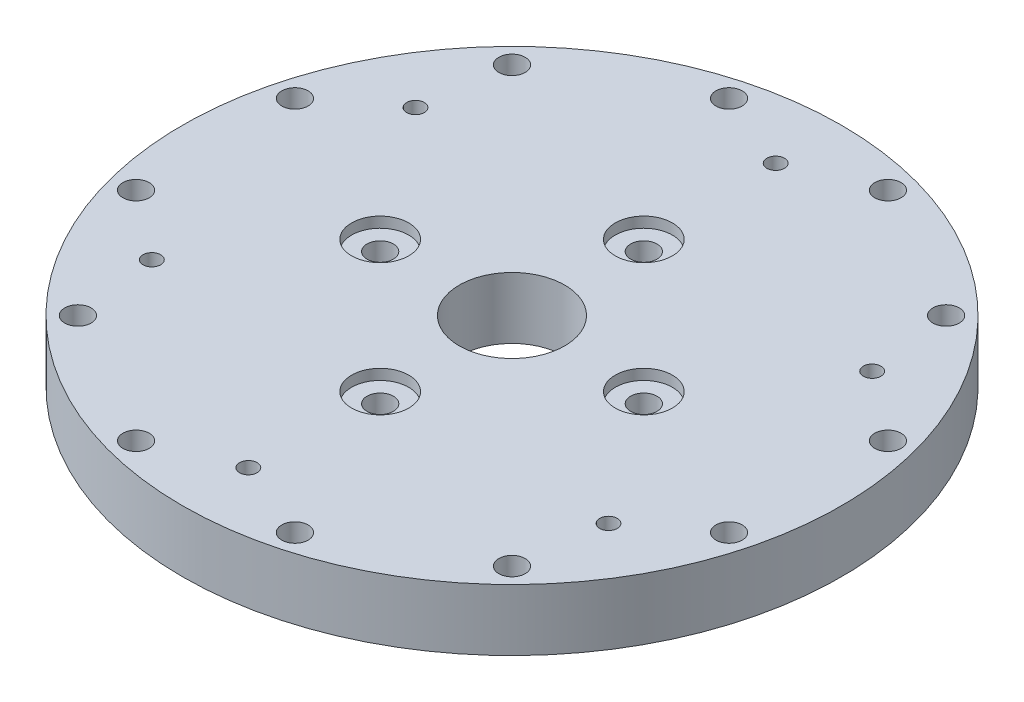
from build123d import *

# Parameters (mm, degrees)
SKETCH1_R           = 37.5
SKETCH1_R_2         = 6
SKETCH1_R_3         = 1.5
SKETCH1_R_4         = 1
BOSS_EXTRUDE1_DEPTH = 7
SKETCH2_R           = 3.25
CUT_EXTRUDE1_DEPTH  = 1.2


with BuildPart() as part:
    # Sketch1 → Boss-Extrude1 (new body)
    with BuildSketch(Plane(origin=(0, 0, 0), x_dir=(1, 0, 0), z_dir=(0, 1, 0))):
        Circle(SKETCH1_R)
        Circle(SKETCH1_R_2, mode=Mode.SUBTRACT)
        with Locations((0, 15)):
            Circle(SKETCH1_R_3, mode=Mode.SUBTRACT)
        with Locations((15, 0)):
            Circle(SKETCH1_R_3, mode=Mode.SUBTRACT)
        with Locations((0, -15)):
            Circle(SKETCH1_R_3, mode=Mode.SUBTRACT)
        with Locations((-15, 0)):
            Circle(SKETCH1_R_3, mode=Mode.SUBTRACT)
        with Locations((-33.737040436, -9.03981274)):
            Circle(SKETCH1_R_3, mode=Mode.SUBTRACT)
        with Locations((-33.737040436, 9.03981274)):
            Circle(SKETCH1_R_3, mode=Mode.SUBTRACT)
        with Locations((-24.697227696, 24.697227696)):
            Circle(SKETCH1_R_3, mode=Mode.SUBTRACT)
        with Locations((-9.03981274, 33.737040436)):
            Circle(SKETCH1_R_3, mode=Mode.SUBTRACT)
        with Locations((9.03981274, 33.737040436)):
            Circle(SKETCH1_R_3, mode=Mode.SUBTRACT)
        with Locations((24.697227696, 24.697227696)):
            Circle(SKETCH1_R_3, mode=Mode.SUBTRACT)
        with Locations((33.737040436, 9.03981274)):
            Circle(SKETCH1_R_3, mode=Mode.SUBTRACT)
        with Locations((33.737040436, -9.03981274)):
            Circle(SKETCH1_R_3, mode=Mode.SUBTRACT)
        with Locations((24.697227696, -24.697227696)):
            Circle(SKETCH1_R_3, mode=Mode.SUBTRACT)
        with Locations((9.03981274, -33.737040436)):
            Circle(SKETCH1_R_3, mode=Mode.SUBTRACT)
        with Locations((-9.03981274, -33.737040436)):
            Circle(SKETCH1_R_3, mode=Mode.SUBTRACT)
        with Locations((-24.697227696, -24.697227696)):
            Circle(SKETCH1_R_3, mode=Mode.SUBTRACT)
        with Locations((0, 30)):
            Circle(SKETCH1_R_4, mode=Mode.SUBTRACT)
        with Locations((25.980762114, 15)):
            Circle(SKETCH1_R_4, mode=Mode.SUBTRACT)
        with Locations((25.980762114, -15)):
            Circle(SKETCH1_R_4, mode=Mode.SUBTRACT)
        with Locations((0, -30)):
            Circle(SKETCH1_R_4, mode=Mode.SUBTRACT)
        with Locations((-25.980762114, -15)):
            Circle(SKETCH1_R_4, mode=Mode.SUBTRACT)
        with Locations((-25.980762114, 15)):
            Circle(SKETCH1_R_4, mode=Mode.SUBTRACT)
    extrude(amount=BOSS_EXTRUDE1_DEPTH)

    # Sketch2 → Cut-Extrude1 (cut)
    with BuildSketch(Plane(origin=(0, 7, 0), x_dir=(1, 0, 0), z_dir=(0, 1, 0))):
        with Locations((0, 15)):
            Circle(SKETCH2_R)
        with Locations((15, 0)):
            Circle(SKETCH2_R)
        with Locations((0, -15)):
            Circle(SKETCH2_R)
        with Locations((-15, 0)):
            Circle(SKETCH2_R)
    extrude(amount=-CUT_EXTRUDE1_DEPTH, mode=Mode.SUBTRACT)


solid = part.part
